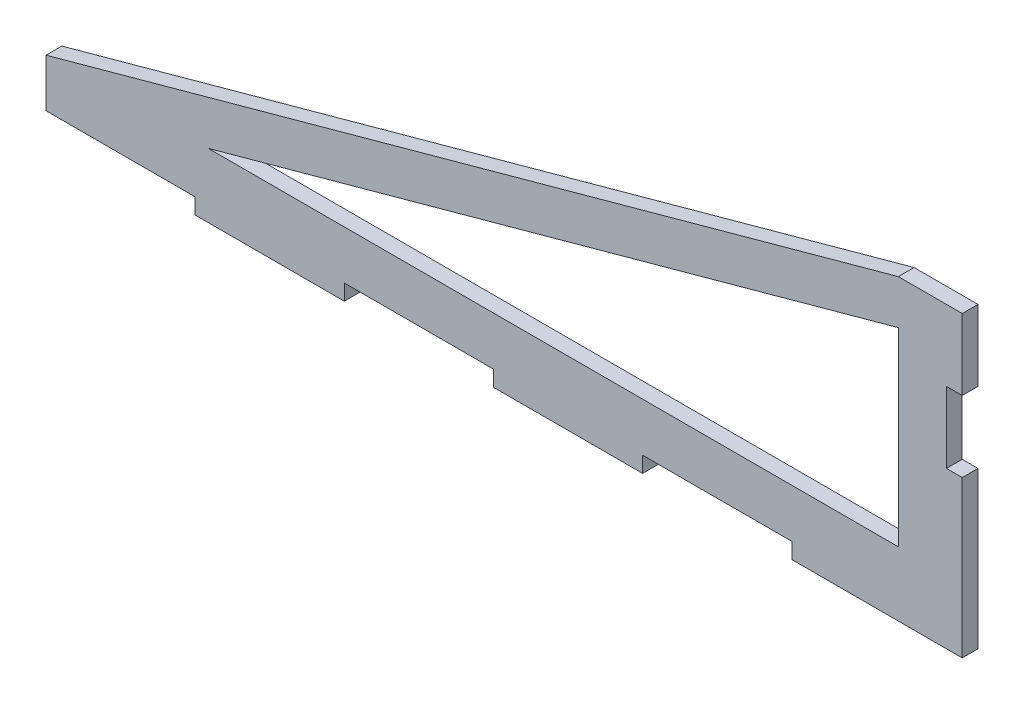
from build123d import *

# Parameters (mm, degrees)
BOSS_EXTRUDE1_DEPTH = 4.699
SKETCH2_W           = 44.45
SKETCH2_H           = 4.699
CUT_EXTRUDE1_DEPTH  = 288.196060581
CAVITY3_START       = 268.350970906
CAVITY3_OUTLINE_W   = 21.166666666
CAVITY3_OUTLINE_H   = 4.699
CAVITY3_DEPTH       = 4.699


# Read off the part's stored shape, not the designer's step: Cavity3
with BuildPart() as part:
    # Sketch1 → Boss-Extrude1 (new body)
    with BuildSketch(Plane.XY):
        Polygon((273.049970906, 58.684987569), (273.049970906, 88.9), (253.999970906, 88.9), (0, 19.05), (0, 0), (273.049970906, 0), (273.049970906, 30.215012431), align=None)
        Polygon((48.33831711, 19.171571116), (253.999970906, 19.171571116), (253.999970906, 75.728532388), align=None, mode=Mode.SUBTRACT)
    extrude(amount=BOSS_EXTRUDE1_DEPTH)

    # Sketch2 → Cut-Extrude1 (cut, through all)
    with BuildSketch(Plane(origin=(0, 0, 0), x_dir=(-1, 0, 0), z_dir=(0, 0, -1))):
        with Locations((-22.225, 2.3495)):
            Rectangle(SKETCH2_W, SKETCH2_H)
        with Locations((-111.125, 2.3495)):
            Rectangle(SKETCH2_W, SKETCH2_H)
        with Locations((-200.025, 2.3495)):
            Rectangle(SKETCH2_W, SKETCH2_H)
    extrude(amount=-CUT_EXTRUDE1_DEPTH, mode=Mode.SUBTRACT)

    # Cavity3 outline → Cavity3 (cut)
    with BuildSketch(Plane.YZ.offset(CAVITY3_START)):
        with Locations((57.15, 2.3495)):
            Rectangle(CAVITY3_OUTLINE_W, CAVITY3_OUTLINE_H)
    extrude(amount=CAVITY3_DEPTH, mode=Mode.SUBTRACT)


solid = part.part
